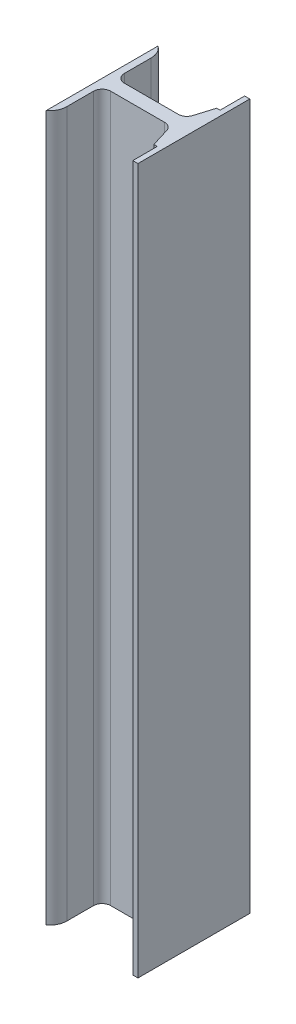
from build123d import *

# Parameters (mm, degrees)
BOSS_EXTRUDE2_DEPTH = 410
FILLET1_R           = 10
FILLET2_R           = 5


with BuildPart() as part:
    # Sketch1 → Boss-Extrude2 (new body)
    with BuildSketch(Plane(origin=(0, 0, 0), x_dir=(1, 0, 0), z_dir=(0, 1, 0))):
        Polygon((-113.923660484, 64.911766887), (-73.923660484, 64.911766887), (-69.59269291, 79.161766887), (-67.59269291, 79.161766887), (-67.59269291, 93.411766887), (-64.59269291, 93.411766887), (-64.59269291, 28.411766887), (-67.59269291, 28.411766887), (-67.59269291, 42.661766887), (-69.59269291, 42.661766887), (-73.923660484, 56.911766887), (-113.923660484, 56.911766887), (-113.923660484, 28.411766887), (-117.923660484, 28.411766887), (-117.923660484, 93.411766887), (-113.923660484, 93.411766887), align=None)
    extrude(amount=BOSS_EXTRUDE2_DEPTH)

    # Fillet1
    # the kernel refuses this fillet: 10 mm, written as the material it takes off along each edge
    with BuildSketch(Plane(origin=(-113.923660484, -20, -93.411766887), x_dir=(-1, 0, 0), z_dir=(0, 1, 0))) as fillet1_piece_1:
        with BuildLine():
            CenterArc((10, 8), FILLET1_R, 180, 53.130102354)
            Line((0, 8), (-0.2, 8))
            Line((-0.2, 8), (-0.2, 0))
            Line((-0.2, 0), (0, -0.2))
            ThreePointArc((0, -0.2), (2, -0.2), (3.88, -0.16))
            Line((3.88, -0.16), (4, 0))
        make_face()
    extrude(amount=450, mode=Mode.SUBTRACT)
    with BuildSketch(Plane(origin=(-113.923660484, -20, -28.411766887), x_dir=(0, 0, -1), z_dir=(0, 1, 0))) as fillet1_piece_2:
        with BuildLine():
            CenterArc((8, 10), FILLET1_R, 216.869897646, 53.130102354)
            Line((0, 4), (-0.16, 3.88))
            ThreePointArc((-0.16, 3.88), (-0.2, 2), (-0.2, 0))
            Line((-0.2, 0), (0, -0.2))
            Line((0, -0.2), (8, -0.2))
            Line((8, -0.2), (8, 0))
        make_face()
    extrude(amount=450, mode=Mode.SUBTRACT)

    # Fillet2
    fillet2_edges = [part.edges().sort_by_distance(p)[0] for p in [
        (-113.923660484, 205, -64.911766887),
        (-73.923660484, 205, -64.911766887),
        (-73.923660484, 205, -56.911766887),
        (-113.923660484, 205, -56.911766887),
    ]]
    fillet(fillet2_edges, radius=FILLET2_R)


solid = part.part
